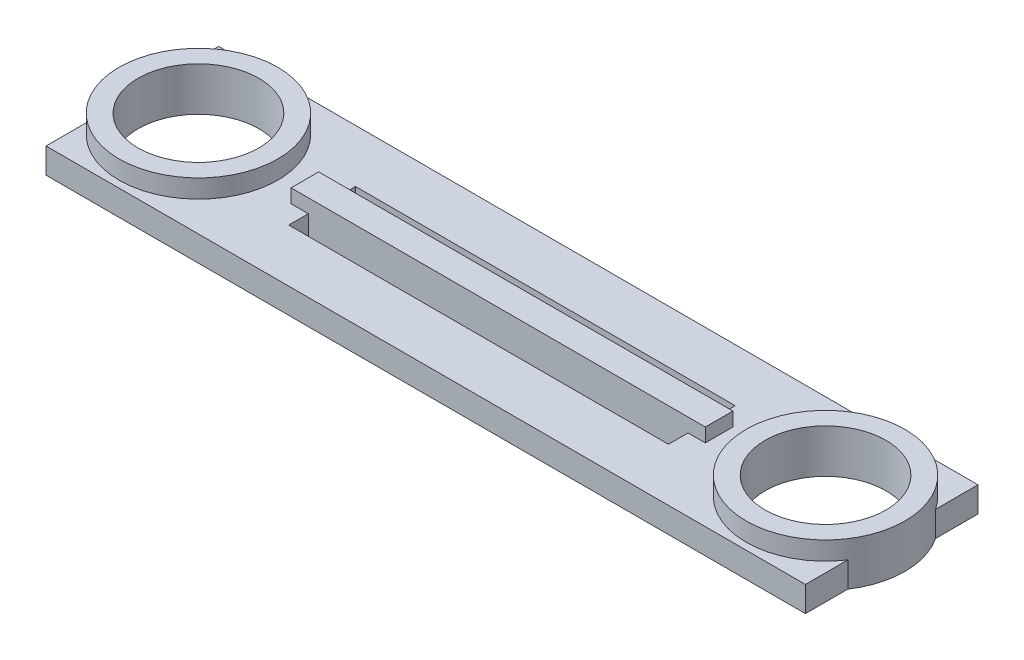
from build123d import *

# Parameters (mm, degrees)
F_01_LINK_PROFILE_W            = 660
F_01_LINK_PROFILE_H            = 150
F_01_LINK_PROFILE_R            = 52.5
F_01_LINK_PROFILE_W_2          = 330
F_01_LINK_PROFILE_H_2          = 58
F_01_LINK_PLATE_DEPTH          = 22
F_02_END_BOSS_PROFILES_R       = 69
F_02_END_BOSS_PROFILES_R_2     = 52.5
F_02_BEARING_SEAT_BOSSES_DEPTH = 38
F_03_CENTER_RIB_PROFILE_W      = 360
F_03_CENTER_RIB_PROFILE_H      = 24
F_03_CENTER_RIB_DEPTH          = 34


with BuildPart() as part:
    # 01_Link_Profile → 01_Link_Plate (new body)
    with BuildSketch(Plane(origin=(0, 0, 0), x_dir=(1, 0, 0), z_dir=(0, 1, 0))):
        Rectangle(F_01_LINK_PROFILE_W, F_01_LINK_PROFILE_H)
        with Locations((-272.5, 0)):
            Circle(F_01_LINK_PROFILE_R, mode=Mode.SUBTRACT)
        with Locations((272.5, 0)):
            Circle(F_01_LINK_PROFILE_R, mode=Mode.SUBTRACT)
        Rectangle(F_01_LINK_PROFILE_W_2, F_01_LINK_PROFILE_H_2, mode=Mode.SUBTRACT)
    extrude(amount=F_01_LINK_PLATE_DEPTH)

    # 02_End_Boss_Profiles → 02_Bearing_Seat_Bosses (add)
    # profile 1 of 2: a face of its own
    with BuildSketch(Plane(origin=(0, 0, 0), x_dir=(1, 0, 0), z_dir=(0, 1, 0))):
        with Locations((-272.5, 0)):
            Circle(F_02_END_BOSS_PROFILES_R)
        with Locations((-272.5, 0)):
            Circle(F_02_END_BOSS_PROFILES_R_2, mode=Mode.SUBTRACT)
    # profile 2 of 2: a face of its own
    with BuildSketch(Plane(origin=(0, 0, 0), x_dir=(1, 0, 0), z_dir=(0, 1, 0))):
        with Locations((272.5, 0)):
            Circle(F_02_END_BOSS_PROFILES_R)
        with Locations((272.5, 0)):
            Circle(F_02_END_BOSS_PROFILES_R_2, mode=Mode.SUBTRACT)
    extrude(amount=F_02_BEARING_SEAT_BOSSES_DEPTH)

    # 03_Center_Rib_Profile → 03_Center_Rib (add)
    with BuildSketch(Plane(origin=(0, 0, 0), x_dir=(1, 0, 0), z_dir=(0, 1, 0))):
        Rectangle(F_03_CENTER_RIB_PROFILE_W, F_03_CENTER_RIB_PROFILE_H)
    extrude(amount=F_03_CENTER_RIB_DEPTH)


solid = part.part
